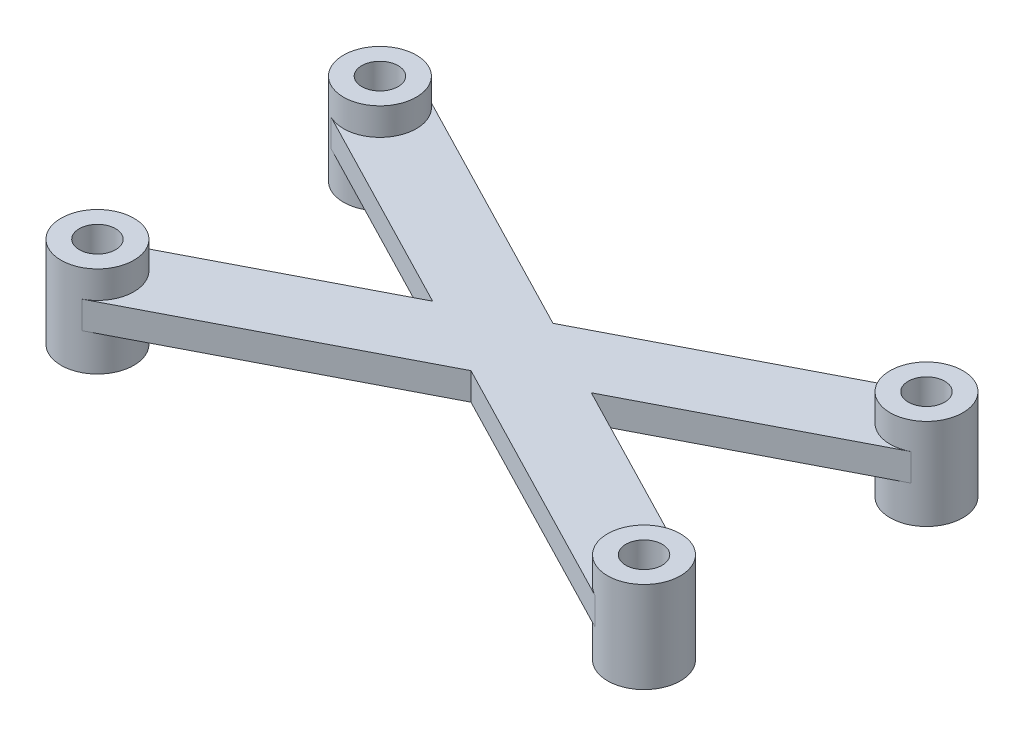
from build123d import *

# Parameters (mm, degrees)
CROQUIS1_R                = 4
CROQUIS1_R_2              = 2
SALIENTE_EXTRUIR1_DEPTH   = 4
SALIENTE_EXTRUIR1_2_DEPTH = 4
SALIENTE_EXTRUIR1_3_DEPTH = 4
SALIENTE_EXTRUIR1_4_DEPTH = 4
SALIENTE_EXTRUIR1_5_DEPTH = 4
CROQUIS3_R                = 2
SALIENTE_EXTRUIR4_DEPTH   = 3
CROQUIS4_R                = 4
CROQUIS4_R_2              = 2
CORTAR_EXTRUIR1_DEPTH     = 4
CROQUIS5_R                = 2
SALIENTE_EXTRUIR5_DEPTH   = 3
CROQUIS6_R                = 4
CROQUIS6_R_2              = 2
SALIENTE_EXTRUIR6_DEPTH   = 3


with BuildPart() as part:
    # Croquis1 → Saliente-Extruir1 (new body)
    with BuildSketch(Plane(origin=(0, 0, 0), x_dir=(1, 0, 0), z_dir=(0, 1, 0))):
        Circle(CROQUIS1_R)
        Circle(CROQUIS1_R_2, mode=Mode.SUBTRACT)
    extrude(amount=SALIENTE_EXTRUIR1_DEPTH)



with BuildPart() as body_2:
    # Croquis1 → Saliente-Extruir1 2 (new body)
    with BuildSketch(Plane(origin=(0, 0, 0), x_dir=(1, 0, 0), z_dir=(0, 1, 0))):
        with Locations((60.02, 0)):
            Circle(CROQUIS1_R)
        with Locations((60.02, 0)):
            Circle(CROQUIS1_R_2, mode=Mode.SUBTRACT)
    extrude(amount=SALIENTE_EXTRUIR1_2_DEPTH)


with BuildPart() as body_3:
    # Croquis1 → Saliente-Extruir1 3 (new body)
    with BuildSketch(Plane(origin=(0, 0, 0), x_dir=(1, 0, 0), z_dir=(0, 1, 0))):
        with Locations((60.02, -31.02)):
            Circle(CROQUIS1_R)
        with Locations((60.02, -31.02)):
            Circle(CROQUIS1_R_2, mode=Mode.SUBTRACT)
    extrude(amount=SALIENTE_EXTRUIR1_3_DEPTH)


with BuildPart() as body_4:
    # Croquis1 → Saliente-Extruir1 4 (new body)
    with BuildSketch(Plane(origin=(0, 0, 0), x_dir=(1, 0, 0), z_dir=(0, 1, 0))):
        with Locations((0, -31.02)):
            Circle(CROQUIS1_R)
        with Locations((0, -31.02)):
            Circle(CROQUIS1_R_2, mode=Mode.SUBTRACT)
    extrude(amount=SALIENTE_EXTRUIR1_4_DEPTH)


with BuildPart() as body_5:
    # Croquis1 → Saliente-Extruir1 5 (new body)
    with BuildSketch(Plane(origin=(0, 0, 0), x_dir=(1, 0, 0), z_dir=(0, 1, 0))):
        with Locations((30.01, -15.51)):
            Circle(CROQUIS1_R)
        with Locations((30.01, -15.51)):
            Circle(CROQUIS1_R_2, mode=Mode.SUBTRACT)
    extrude(amount=SALIENTE_EXTRUIR1_5_DEPTH)

    # Croquis4 → Cortar-Extruir1 (cut)
    with BuildSketch(Plane.XZ):
        with Locations((30.01, 15.51)):
            Circle(CROQUIS4_R)
        with Locations((30.01, 15.51)):
            Circle(CROQUIS4_R_2, mode=Mode.SUBTRACT)
    extrude(amount=-CORTAR_EXTRUIR1_DEPTH, mode=Mode.SUBTRACT)


with BuildPart() as part_1:
    add(part.part)

    add(body_4.part)  # Saliente-Extruir4 merges body 4

    add(body_2.part)  # Saliente-Extruir4 merges body 2

    add(body_3.part)  # Saliente-Extruir4 merges body 3
    # Croquis3 → Saliente-Extruir4 (add)
    with BuildSketch(Plane(origin=(0, 4, 0), x_dir=(1, 0, 0), z_dir=(0, 1, 0))):
        with BuildLine():
            Line((21.297927081, -15.51), (-1.836531919, -27.466529793))
            ThreePointArc((-1.836531919, -27.466529793), (-3.553470207, -32.856531919), (1.836531919, -34.573470207))
            Line((1.836531919, -34.573470207), (30.01, -20.012640819))
            Line((30.01, -20.012640819), (58.183468081, -34.573470207))
            ThreePointArc((58.183468081, -34.573470207), (63.573470207, -32.856531919), (61.856531919, -27.466529793))
            Line((61.856531919, -27.466529793), (38.722072919, -15.51))
            Line((38.722072919, -15.51), (61.856531919, -3.553470207))
            ThreePointArc((61.856531919, -3.553470207), (63.573470207, 1.836531919), (58.183468081, 3.553470207))
            Line((58.183468081, 3.553470207), (30.01, -11.007359181))
            Line((30.01, -11.007359181), (1.836531919, 3.553470207))
            ThreePointArc((1.836531919, 3.553470207), (-3.553470207, 1.836531919), (-1.836531919, -3.553470207))
            Line((-1.836531919, -3.553470207), (21.297927081, -15.51))
        make_face()
        with BuildLine():
            ThreePointArc((28.01, -15.51), (28.595786438, -14.095786438), (30.01, -13.51))
            ThreePointArc((30.01, -13.51), (31.424213562, -16.924213562), (28.01, -15.51))
        make_face(mode=Mode.SUBTRACT)
        with Locations((0, -31.02)):
            Circle(CROQUIS3_R, mode=Mode.SUBTRACT)
        Circle(CROQUIS3_R, mode=Mode.SUBTRACT)
        with Locations((60.02, 0)):
            Circle(CROQUIS3_R, mode=Mode.SUBTRACT)
        with Locations((60.02, -31.02)):
            Circle(CROQUIS3_R, mode=Mode.SUBTRACT)
    extrude(amount=SALIENTE_EXTRUIR4_DEPTH)

    # Croquis5 → Saliente-Extruir5 (add)
    with BuildSketch(Plane.XZ.offset(-4)):
        with Locations((30.01, 15.51)):
            Circle(CROQUIS5_R)
    extrude(amount=-SALIENTE_EXTRUIR5_DEPTH)

    # Croquis6 → Saliente-Extruir6 (add)
    # profile 1 of 4: a face of its own
    with BuildSketch(Plane(origin=(0, 7, 0), x_dir=(1, 0, 0), z_dir=(0, 1, 0))):
        with Locations((60.02, 0)):
            Circle(CROQUIS6_R)
        with Locations((60.02, 0)):
            Circle(CROQUIS6_R_2, mode=Mode.SUBTRACT)
    # profile 2 of 4: a face of its own
    with BuildSketch(Plane(origin=(0, 7, 0), x_dir=(1, 0, 0), z_dir=(0, 1, 0))):
        Circle(CROQUIS6_R)
        Circle(CROQUIS6_R_2, mode=Mode.SUBTRACT)
    # profile 3 of 4: a face of its own
    with BuildSketch(Plane(origin=(0, 7, 0), x_dir=(1, 0, 0), z_dir=(0, 1, 0))):
        with Locations((0, -31.02)):
            Circle(CROQUIS6_R)
        with Locations((0, -31.02)):
            Circle(CROQUIS6_R_2, mode=Mode.SUBTRACT)
    # profile 4 of 4: a face of its own
    with BuildSketch(Plane(origin=(0, 7, 0), x_dir=(1, 0, 0), z_dir=(0, 1, 0))):
        with Locations((60.02, -31.02)):
            Circle(CROQUIS6_R)
        with Locations((60.02, -31.02)):
            Circle(CROQUIS6_R_2, mode=Mode.SUBTRACT)
    extrude(amount=SALIENTE_EXTRUIR6_DEPTH)


solid = part_1.part
